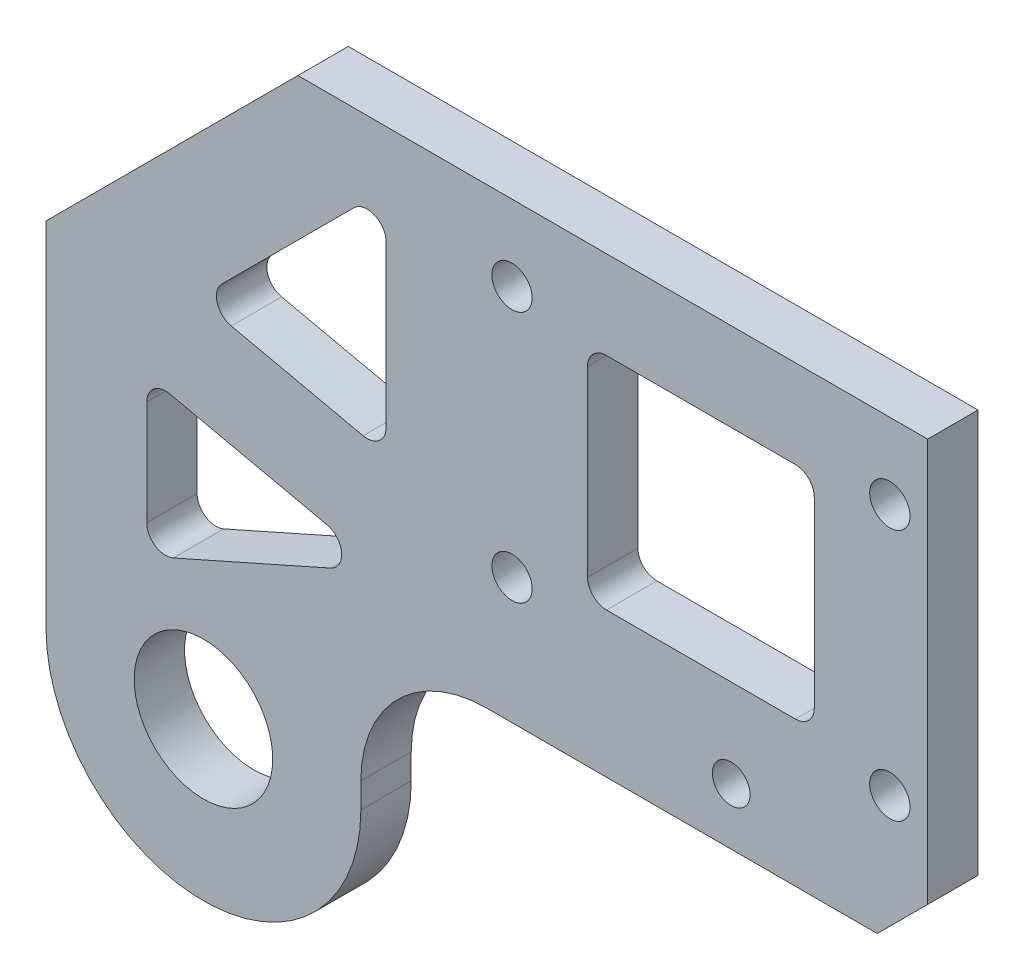
from build123d import *

# Parameters (mm, degrees)
SKETCH_1_R          = 1.6
SKETCH_1_R_2        = 6.075
EXTRUDE_1_DEPTH     = 4
CUT_EXTRUDE_3_REACH = 75.125
SKETCH_4_R          = 1.5
EXTRUDE_START       = -4
SKETCH_5_R          = 6.075
SKETCH_5_R_2        = 5.5
EXTRUDE_2_DEPTH     = 4
CHAMFER_1_SIZE      = 20
CUT_EXTRUDE_4_DEPTH = 10
CHAMFER1_SIZE       = 4


with BuildPart() as part:
    # 草图1 → 凸台-拉伸1 (new body)
    with BuildSketch(Plane(origin=(0, 0, 0), x_dir=(-1, 0, 0), z_dir=(0, 0, -1))):
        with BuildLine():
            Line((12.5, -3), (12.5, 12))
            Line((12.5, 12), (12.5, 45))
            Line((12.5, 45), (-17.5, 45))
            Line((-17.5, 45), (-57.5, 45))
            Line((-57.5, 45), (-57.5, 9))
            Line((-57.5, 9), (-22.5, 9))
            ThreePointArc((-22.5, 9), (-15.428932188, 6.071067812), (-12.5, -1))
            Line((-12.5, -1), (-12.5, -3))
            ThreePointArc((-12.5, -3), (0, -15.5), (12.5, -3))
        make_face()
        with Locations((-54.5, 19)):
            Circle(SKETCH_1_R, mode=Mode.SUBTRACT)
        with Locations((-24.5, 19)):
            Circle(SKETCH_1_R, mode=Mode.SUBTRACT)
        with Locations((-24.5, 39)):
            Circle(SKETCH_1_R, mode=Mode.SUBTRACT)
        with Locations((-54.5, 39)):
            Circle(SKETCH_1_R, mode=Mode.SUBTRACT)
        with Locations((0, -3)):
            Circle(SKETCH_1_R_2, mode=Mode.SUBTRACT)
    extrude(amount=-EXTRUDE_1_DEPTH)

    # 草图4 → 切除-拉伸3 (cut, up to next)
    with BuildSketch(Plane.XY.offset(4), mode=Mode.PRIVATE) as cut_extrude_3_sk1:
        with Locations((41.903612375, 13.5)):
            Circle(SKETCH_4_R)
    cut_extrude_3_tool1 = extrude(cut_extrude_3_sk1.sketch, amount=-CUT_EXTRUDE_3_REACH, mode=Mode.PRIVATE) & part.part
    add(cut_extrude_3_tool1.solids().sort_by_distance((41.903612, 13.5, 4))[0], mode=Mode.SUBTRACT)

    # 草图5 → 凸台-拉伸2 (add)
    with BuildSketch(Plane.XY.offset(4).offset(EXTRUDE_START)):
        with Locations((0, -3)):
            Circle(SKETCH_5_R)
        with Locations((0, -3)):
            Circle(SKETCH_5_R_2, mode=Mode.SUBTRACT)
    extrude(amount=EXTRUDE_2_DEPTH)

    # 倒角1
    chamfer_1_edges = [part.edges().sort_by_distance(p)[0] for p in [
        (-12.5, 45, 2),
    ]]
    chamfer(chamfer_1_edges, length=CHAMFER_1_SIZE)

    # 草图6 → 切除-拉伸4 (cut)
    with BuildSketch(Plane.XY.offset(4)):
        with BuildLine():
            Line((30.5, 36.5), (30.5, 22))
            ThreePointArc((30.5, 22), (30.939339828, 20.939339828), (32, 20.5))
            Line((32, 20.5), (47, 20.5))
            ThreePointArc((47, 20.5), (48.060660172, 20.939339828), (48.5, 22))
            Line((48.5, 22), (48.5, 36.5))
            ThreePointArc((48.5, 36.5), (48.060660172, 37.560660172), (47, 38))
            Line((47, 38), (32, 38))
            ThreePointArc((32, 38), (30.939339828, 37.560660172), (30.5, 36.5))
        make_face()
        with BuildLine():
            Line((11.939339828, 38.125631329), (1.473803252, 27.660094753))
            ThreePointArc((1.473803252, 27.660094753), (1.094480301, 26.179376719), (2.210443374, 25.134848972))
            Line((2.210443374, 25.134848972), (12.67597995, 22.819488461))
            ThreePointArc((12.67597995, 22.819488461), (13.939140545, 23.11445232), (14.5, 24.28407407))
            Line((14.5, 24.28407407), (14.5, 37.064971157))
            ThreePointArc((14.5, 37.064971157), (13.574025149, 38.450790456), (11.939339828, 38.125631329))
        make_face()
        with BuildLine():
            Line((-4.5, 16.557875528), (-4.5, 8.251212083))
            ThreePointArc((-4.5, 8.251212083), (-3.817403706, 6.99349543), (-2.390865092, 6.880462411))
            Line((-2.390865092, 6.880462411), (10.088769396, 12.42617302))
            ThreePointArc((10.088769396, 12.42617302), (10.972107632, 13.947002392), (9.803654539, 15.261508302))
            Line((9.803654539, 15.261508302), (-2.67597995, 18.022461137))
            ThreePointArc((-2.67597995, 18.022461137), (-3.939140545, 17.727497278), (-4.5, 16.557875528))
        make_face()
    extrude(amount=-CUT_EXTRUDE_4_DEPTH, mode=Mode.SUBTRACT)

    # Chamfer1
    chamfer1_edges = [part.edges().sort_by_distance(p)[0] for p in [
        (57.5, 9, 2),
    ]]
    chamfer(chamfer1_edges, length=CHAMFER1_SIZE)


solid = part.part
